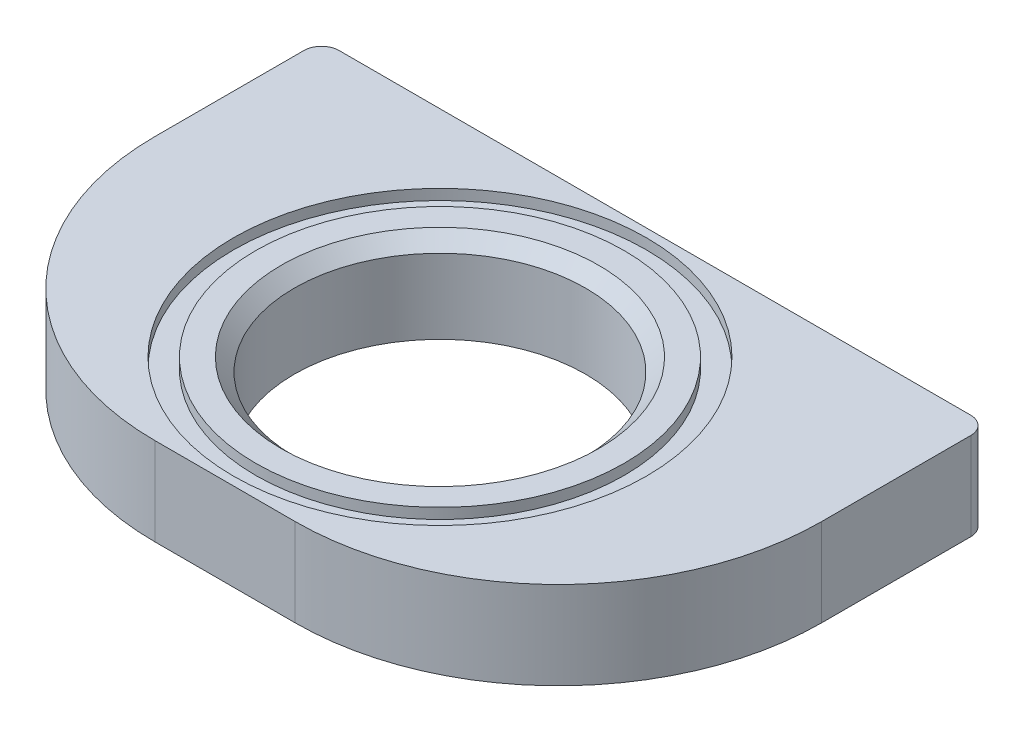
from build123d import *

# Parameters (mm, degrees)
SKETCH1_W           = 38
SKETCH1_H           = 24.5
SKETCH1_R           = 8.3
BOSS_EXTRUDE1_DEPTH = 5
FILLET1_R           = 15
FILLET2_R           = 1
CHAMFER1_SIZE       = 0.75
SKETCH3_W           = 1.267094865
SKETCH3_H           = 1.151259449


with BuildPart() as part:
    # Sketch1 → Boss-Extrude1 (new body)
    with BuildSketch(Plane(origin=(0, 0, 0), x_dir=(1, 0, 0), z_dir=(0, 1, 0))):
        Rectangle(SKETCH1_W, SKETCH1_H)
        Circle(SKETCH1_R, mode=Mode.SUBTRACT)
    extrude(amount=BOSS_EXTRUDE1_DEPTH)

    # Fillet1
    fillet1_edges = [part.edges().sort_by_distance(p)[0] for p in [
        (19, 2.5, 12.25),
        (-19, 2.5, 12.25),
    ]]
    fillet(fillet1_edges, radius=FILLET1_R)

    # Fillet2
    fillet2_edges = [part.edges().sort_by_distance(p)[0] for p in [
        (-19, 2.5, -12.25),
        (19, 2.5, -12.25),
    ]]
    fillet(fillet2_edges, radius=FILLET2_R)

    # Chamfer1
    chamfer1_edges = [part.edges().sort_by_distance(p)[0] for p in [
        (-8.3, 5, 0),
    ]]
    chamfer(chamfer1_edges, length=CHAMFER1_SIZE)

    # o-ring: sweep along a path in Sketch4
    with BuildLine(Plane(origin=(0, 5, 0), x_dir=(1, 0, 0), z_dir=(0, 1, 0))) as o_ring_path:
        CenterArc((0, 0), 11, 0, 360)
    # Sketch3 → o-ring (sweep, cut)
    with BuildSketch(Plane.XY):
        with Locations((-11.133547433, 4.975629725)):
            Rectangle(SKETCH3_W, SKETCH3_H)
    sweep(path=o_ring_path.line, mode=Mode.SUBTRACT)


solid = part.part
